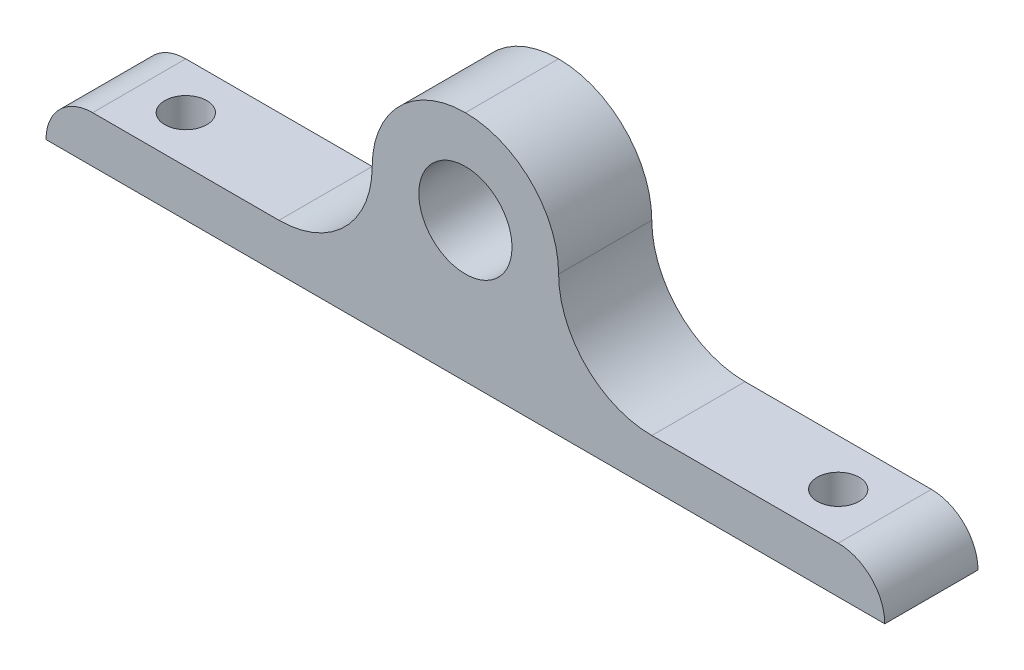
from build123d import *

# Parameters (mm, degrees)
SKETCH1_R            = 5
BOSS_EXTRUDE1_DEPTH  = 10
FILLET1_DEPTH        = 10
FILLET1_2_DEPTH      = 10
M4_CLEARANCE_HOLE1_D = 4.5
FILLET2_R            = 5


with BuildPart() as part:
    # Sketch1 → Boss-Extrude1 (new body)
    with BuildSketch(Plane.XY):
        Polygon((10, -10), (45, -10), (45, -15), (-45, -15), (-45, -10), (-10, -10), (-10, 10), (10, 10), align=None)
        Circle(SKETCH1_R, mode=Mode.SUBTRACT)
    extrude(amount=BOSS_EXTRUDE1_DEPTH)

    # Fillet1: read off the stored shape, not the designer's step
    # Fillet1 outline → Fillet1 (cut)
    with BuildSketch(Plane.XY):
        with BuildLine():
            Line((10, 10), (0, 10))
            ThreePointArc((0, 10), (7.071067812, 7.071067812), (10, 0))
            Line((10, 0), (10, 10))
        make_face()
        with BuildLine():
            Line((-10, 10), (-10, 0))
            ThreePointArc((-10, 0), (-7.071067812, 7.071067812), (0, 10))
            Line((0, 10), (-10, 10))
        make_face()
    extrude(amount=FILLET1_DEPTH, mode=Mode.SUBTRACT)

    # Fillet1 2 outline → Fillet1 2 (add)
    with BuildSketch(Plane.XY):
        with BuildLine():
            ThreePointArc((20, -10), (12.928932188, -7.071067812), (10, 0))
            Line((10, 0), (10, -10))
            Line((10, -10), (20, -10))
        make_face()
        with BuildLine():
            ThreePointArc((-10, 0), (-12.928932188, -7.071067812), (-20, -10))
            Line((-20, -10), (-10, -10))
            Line((-10, -10), (-10, 0))
        make_face()
    extrude(amount=FILLET1_2_DEPTH)

    # M4 Clearance Hole1 (through all)
    with Locations(Plane(origin=(0, -10, 0), x_dir=(1, 0, 0), z_dir=(0, 1, 0))):
        with Locations((-35, -5), (35, -5)):
            Hole(M4_CLEARANCE_HOLE1_D / 2)

    # Fillet2
    fillet2_edges = [part.edges().sort_by_distance(p)[0] for p in [
        (45, -10, 5),
        (-45, -10, 5),
    ]]
    fillet(fillet2_edges, radius=FILLET2_R - 0.0001)  # a hair under: the kernel refuses the full size


solid = part.part
